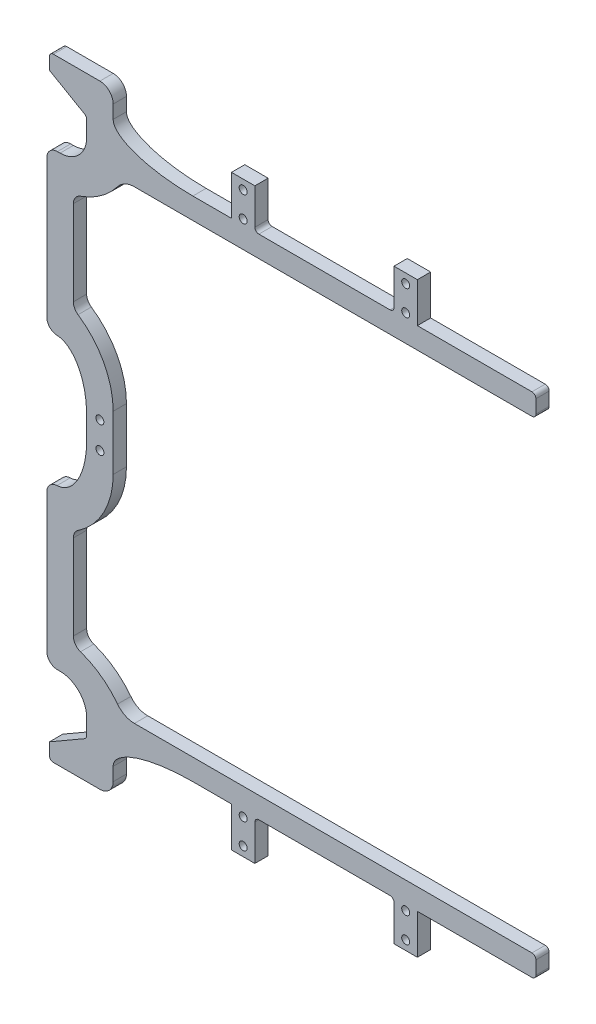
from build123d import *

# Parameters (mm, degrees)
SKETCH_1_R          = 1.5
SKETCH_1_W          = 10
SKETCH_1_H          = 20
EXTRUDE_1_DEPTH     = 5
FILLET_1_R          = 1.5
FILLET_2_R          = 8
EXTRUDE_5_DEPTH     = 5
SKETCH_7_R          = 1.5
CUT_EXTRUDE_1_DEPTH = 259.028370533
FILLET_5_R          = 1.5
EXTRUDE_6_DEPTH     = 5
SKETCH_9_W          = 10
SKETCH_9_H          = 40
CUT_EXTRUDE_2_DEPTH = 259.028370533
FILLET_6_R          = 4
FILLET_8_R          = 10
FILLET_9_R          = 10
FILLET_10_DEPTH     = 5
FILLET_11_DEPTH     = 5
FILLET_13_SIZE      = 10
FILLET_13_SIZE_2    = 30
FILLET_14_SIZE      = 30
FILLET_14_SIZE_2    = 10
FILLET_15_R         = 5
FILLET_16_R         = 30
FILLET_17_R         = 30
FILLET_18_R         = 30


with BuildPart() as part:
    # 草图1 → 凸台-拉伸1 (new body)
    # profile 1 of 3: a face of its own
    with BuildSketch(Plane.XY):
        Polygon((105.75, 0), (114.65, 0), (159.2, 0), (159.2, -8), (114.55, -8), (114.55, -23), (105.75, -23), (105.75, -8), (53.35, -8), (53.35, -23), (44.55, -23), (44.55, -8), (-10, -8), (-10, 183), (44.55, 183), (44.55, 198), (53.35, 198), (53.35, 183), (105.75, 183), (105.75, 198), (114.55, 198), (114.55, 183), (159.2, 183), (159.2, 175), (114.65, 175), (105.75, 175), (53.35, 175), (44.55, 175), (0, 175), (0, 0), (44.55, 0), (53.35, 0), align=None)
        with Locations((48.95, -10)):
            Circle(SKETCH_1_R, mode=Mode.SUBTRACT)
        with Locations((110.15, -19.5)):
            Circle(SKETCH_1_R, mode=Mode.SUBTRACT)
        with Locations((110.15, -10)):
            Circle(SKETCH_1_R, mode=Mode.SUBTRACT)
        with Locations((110.15, 194.5)):
            Circle(SKETCH_1_R, mode=Mode.SUBTRACT)
        with Locations((48.95, 194.5)):
            Circle(SKETCH_1_R, mode=Mode.SUBTRACT)
        with Locations((48.95, 185)):
            Circle(SKETCH_1_R, mode=Mode.SUBTRACT)
        with Locations((110.15, 185)):
            Circle(SKETCH_1_R, mode=Mode.SUBTRACT)
        with Locations((48.95, -19.5)):
            Circle(SKETCH_1_R, mode=Mode.SUBTRACT)
    # profile 2 of 3: a face of its own
    with BuildSketch(Plane.XY):
        with Locations((-5, 193)):
            Rectangle(SKETCH_1_W, SKETCH_1_H)
    # profile 3 of 3: a face of its own
    with BuildSketch(Plane.XY):
        with Locations((-5, -18)):
            Rectangle(SKETCH_1_W, SKETCH_1_H)
    extrude(amount=EXTRUDE_1_DEPTH)

    # 圆角1
    fillet_1_edges = [part.edges().sort_by_distance(p)[0] for p in [
        (159.2, 0, 2.5),
        (159.2, -8, 2.5),
        (105.75, -8, 2.5),
        (53.35, -8, 2.5),
        (53.35, 183, 2.5),
        (105.75, 183, 2.5),
        (159.2, 183, 2.5),
        (159.2, 175, 2.5),
    ]]
    fillet(fillet_1_edges, radius=FILLET_1_R)

    # 圆角2
    fillet_2_edges = [part.edges().sort_by_distance(p)[0] for p in [
        (0, 175, 2.5),
        (0, 0, 2.5),
    ]]
    fillet(fillet_2_edges, radius=FILLET_2_R)

    # 草图6 → 凸台-拉伸5 (add)
    with BuildSketch(Plane.XY.offset(5)):
        Polygon((-24, 197), (-10, 188.917096231), (-10, 203), (-24, 203), align=None)
        Polygon((-10, -28), (-24, -28), (-24, -22), (-10, -13.917096231), align=None)
    extrude(amount=-EXTRUDE_5_DEPTH)

    # 草图7 → 切除-拉伸1 (cut, through all)
    with BuildSketch(Plane(origin=(0, 0, 5), x_dir=(-1, 0, 0), z_dir=(0, 0, -1))):
        with Locations((5, 92.5)):
            Circle(SKETCH_7_R)
        with Locations((5, 82.5)):
            Circle(SKETCH_7_R)
    extrude(amount=CUT_EXTRUDE_1_DEPTH, mode=Mode.SUBTRACT)

    # 圆角5
    fillet_5_edges = [part.edges().sort_by_distance(p)[0] for p in [
        (-24, 203, 2.5),
        (-10, 188.917096231, 2.5),
        (-10, -13.917096231, 2.5),
        (-24, -28, 2.5),
    ]]
    fillet(fillet_5_edges, radius=FILLET_5_R)

    # 草图8 → 凸台-拉伸6 (add, through all)
    with BuildSketch(Plane(origin=(0, 0, 0), x_dir=(-1, 0, 0), z_dir=(0, 0, -1))):
        Polygon((25, 112), (10, 112), (10, 122), (15, 122), (15, 162), (10, 162), (10, 172), (25, 172), align=None)
        Polygon((15, 53), (10, 53), (10, 63), (25, 63), (25, 3), (10, 3), (10, 13), (15, 13), align=None)
    extrude(amount=-EXTRUDE_6_DEPTH)

    # 草图9 → 切除-拉伸2 (cut, through all)
    with BuildSketch(Plane(origin=(0, 0, 0), x_dir=(-1, 0, 0), z_dir=(0, 0, -1))):
        with Locations((5, 142)):
            Rectangle(SKETCH_9_W, SKETCH_9_H)
        with Locations((5, 33)):
            Rectangle(SKETCH_9_W, SKETCH_9_H)
    extrude(amount=-CUT_EXTRUDE_2_DEPTH, mode=Mode.SUBTRACT)

    # 圆角6
    fillet_6_edges = [part.edges().sort_by_distance(p)[0] for p in [
        (-25, 172, 2.5),
        (-25, 112, 2.5),
        (-15, 122, 2.5),
        (-15, 162, 2.5),
        (-25, 63, 2.5),
        (-25, 3, 2.5),
        (-15, 13, 2.5),
        (-15, 53, 2.5),
    ]]
    fillet(fillet_6_edges, radius=FILLET_6_R)

    # 圆角8
    fillet_8_edges = [part.edges().sort_by_distance(p)[0] for p in [
        (-10, 172, 2.5),
    ]]
    fillet(fillet_8_edges, radius=FILLET_8_R)

    # 圆角9
    fillet_9_edges = [part.edges().sort_by_distance(p)[0] for p in [
        (-10, 3, 2.5),
    ]]
    fillet(fillet_9_edges, radius=FILLET_9_R)

    # 圆角10: read off the stored shape, not the designer's step
    # 圆角10 outline → 圆角10 (add)
    with BuildSketch(Plane.XY):
        with BuildLine():
            Line((-10, 63), (-10, 82.979157617))
            add(Edge.make_bspline(
                [(-10, 82.979157617), (-10, 63.462208461), (-21.166666667, 62.996526269)],
                knots=[0, 0, 0, 1, 1, 1], degree=2, weights=[1, 0.721687836, 1]))
            ThreePointArc((-21.166666667, 62.996526269), (-21.083351432, 62.999131473), (-21, 63))
            Line((-21, 63), (-10, 63))
        make_face()
    extrude(amount=FILLET_10_DEPTH)

    # 圆角11: read off the stored shape, not the designer's step
    # 圆角11 outline → 圆角11 (add)
    with BuildSketch(Plane.XY):
        with BuildLine():
            ThreePointArc((-21, 112), (-21.083351432, 112.000868527), (-21.166666667, 112.003473731))
            add(Edge.make_bspline(
                [(-21.166666667, 112.003473731), (-10, 111.537791539), (-10, 92.020842383)],
                knots=[0, 0, 0, 1, 1, 1], degree=2, weights=[1, 0.721687836, 1]))
            Line((-10, 92.020842383), (-10, 112))
            Line((-10, 112), (-21, 112))
        make_face()
    extrude(amount=FILLET_11_DEPTH)

    # 圆角13
    # a fillet whose section is not a circle: 30, 10 mm, written as the material it adds along each edge
    with BuildSketch(Plane(origin=(0, 183, 0), x_dir=(0, 1, 0), z_dir=(0, 0, 1))) as fillet_13_piece_1:
        with BuildLine():
            Bezier((FILLET_13_SIZE, 0), (0, 0), (0, -FILLET_13_SIZE_2), weights=[1, 0.707106781, 1])
            Line((0, -FILLET_13_SIZE_2), (0, 0))
            Line((0, 0), (FILLET_13_SIZE, 0))
        make_face()
    extrude(amount=5)

    # 圆角14
    # a fillet whose section is not a circle: 30, 10 mm, written as the material it adds along each edge
    with BuildSketch(Plane(origin=(0, -8, 0), x_dir=(1, 0, 0), z_dir=(0, 0, 1))) as fillet_14_piece_1:
        with BuildLine():
            Bezier((FILLET_14_SIZE, 0), (0, 0), (0, -FILLET_14_SIZE_2), weights=[1, 0.707106781, 1])
            Line((0, -FILLET_14_SIZE_2), (0, 0))
            Line((0, 0), (FILLET_14_SIZE, 0))
        make_face()
    extrude(amount=5)

    # 圆角15
    fillet_15_edges = [part.edges().sort_by_distance(p)[0] for p in [
        (0, -28, 2.5),
        (0, 203, 2.5),
    ]]
    fillet(fillet_15_edges, radius=FILLET_15_R)

    # 圆角16
    fillet_16_edges = [part.edges().sort_by_distance(p)[0] for p in [
        (0, 162, 2.5),
    ]]
    fillet(fillet_16_edges, radius=FILLET_16_R)

    # 圆角17
    fillet_17_edges = [part.edges().sort_by_distance(p)[0] for p in [
        (0, 13, 2.5),
    ]]
    fillet(fillet_17_edges, radius=FILLET_17_R)

    # 圆角18
    fillet_18_edges = [part.edges().sort_by_distance(p)[0] for p in [
        (0, 53, 2.5),
        (0, 122, 2.5),
    ]]
    fillet(fillet_18_edges, radius=FILLET_18_R)


solid = part.part
